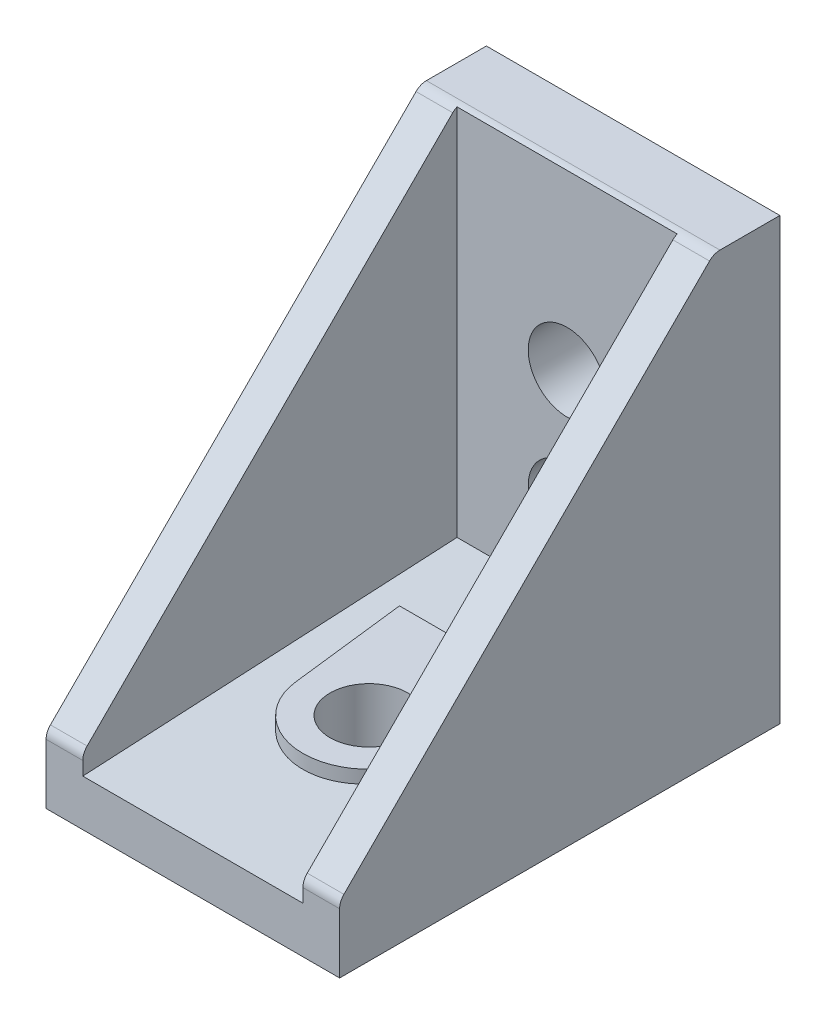
from build123d import *
from build123d.topology import SkipClean

# Parameters (mm, degrees)
BOSS_EXTRUDE1_DEPTH      = 10
BOSS_EXTRUDE1_DEPTH_BACK = 10
CUT_EXTRUDE1_DEPTH       = 7.5
CUT_EXTRUDE1_DEPTH_BACK  = 7.5
BOSS_EXTRUDE2_DEPTH      = 2.25
SKETCH4_R                = 2.65
CUT_EXTRUDE2_DEPTH       = 4.5
SKETCH5_R                = 2.65
CUT_EXTRUDE3_DEPTH       = 4.5
SKETCH6_R                = 2.65
CUT_EXTRUDE4_DEPTH       = 4.5
SKETCH7_W                = 20
SKETCH7_H                = 30
BOSS_EXTRUDE3_DEPTH      = 1
SKETCH8_W                = 20
SKETCH8_H                = 30
CUT_EXTRUDE5_DEPTH       = 1
SKETCH9_W                = 20
SKETCH9_H                = 30
BOSS_EXTRUDE4_DEPTH      = 1
CUT_EXTRUDE6_START       = -1
SKETCH10_W               = 20
SKETCH10_H               = 30
CUT_EXTRUDE6_DEPTH       = 1


with BuildPart() as part:
    # Sketch1 → Boss-Extrude1 (new, two sides: drawn at the far end of the back side and taken through both)
    with BuildSketch(Plane(origin=(0, 0, 0), x_dir=(0, 0, -1), z_dir=(1, 0, 0)).offset(-BOSS_EXTRUDE1_DEPTH_BACK)):
        with BuildLine():
            Line((-30, 4.085786438), (-30, 0))
            Line((-30, 0), (0, 0))
            Line((0, 0), (0, 30))
            Line((0, 30), (-4.085786438, 30))
            ThreePointArc((-4.085786438, 30), (-4.46846987, 29.923879533), (-4.792893219, 29.707106781))
            Line((-4.792893219, 29.707106781), (-29.707106781, 4.792893219))
            ThreePointArc((-29.707106781, 4.792893219), (-29.923879533, 4.46846987), (-30, 4.085786438))
        make_face()
    extrude(amount=BOSS_EXTRUDE1_DEPTH + BOSS_EXTRUDE1_DEPTH_BACK)

    # Sketch2 → Cut-Extrude1 (cut, two sides: drawn at the far end of the back side and taken through both)
    with BuildSketch(Plane(origin=(0, 0, 0), x_dir=(0, 0, -1), z_dir=(1, 0, 0)).offset(-CUT_EXTRUDE1_DEPTH_BACK)):
        Polygon((-34.5, 34.5), (-34.5, 2.927766622), (-4.5, 4.5), (-4.5, 34.5), align=None)
    extrude(amount=CUT_EXTRUDE1_DEPTH + CUT_EXTRUDE1_DEPTH_BACK, mode=Mode.SUBTRACT)

    # Sketch3 → Boss-Extrude2 (add)
    with BuildSketch(Plane(origin=(0, 4.5, 0), x_dir=(1, 0, 0), z_dir=(0, 1, 0))):
        with BuildLine():
            Line((-5.420884207, -10.5), (-4.4686916, -18.529901296))
            ThreePointArc((-4.4686916, -18.529901296), (0, -22.5), (4.4686916, -18.529901296))
            Line((4.4686916, -18.529901296), (5.420884207, -10.5))
            Line((5.420884207, -10.5), (-5.420884207, -10.5))
        make_face()
    extrude(amount=-BOSS_EXTRUDE2_DEPTH)

    # Sketch4 → Cut-Extrude2 (cut)
    with BuildSketch(Plane.XY):
        with Locations((0, 18)):
            Circle(SKETCH4_R)
    extrude(amount=CUT_EXTRUDE2_DEPTH, mode=Mode.SUBTRACT)

    # Sketch5 → Cut-Extrude3 (cut)
    with BuildSketch(Plane.XY):
        with Locations((0, 10)):
            Circle(SKETCH5_R)
    extrude(amount=CUT_EXTRUDE3_DEPTH, mode=Mode.SUBTRACT)

    # Sketch6 → Cut-Extrude4 (cut)
    with BuildSketch(Plane(origin=(0, 0, 0), x_dir=(1, 0, 0), z_dir=(0, 1, 0))):
        with Locations((0, -18)):
            Circle(SKETCH6_R)
    extrude(amount=CUT_EXTRUDE4_DEPTH, mode=Mode.SUBTRACT)

    # Sketch7 → Boss-Extrude3 (add)
    with BuildSketch(Plane(origin=(0, 0, 0), x_dir=(1, 0, 0), z_dir=(0, 1, 0))):
        with Locations((0, -15)):
            Rectangle(SKETCH7_W, SKETCH7_H)
    extrude(amount=-BOSS_EXTRUDE3_DEPTH)

    # Sketch8 → Cut-Extrude5 (cut)
    with BuildSketch(Plane(origin=(0, 0, 0), x_dir=(1, 0, 0), z_dir=(0, 1, 0))):
        with Locations((0, -15)):
            Rectangle(SKETCH8_W, SKETCH8_H)
        with BuildLine():
            Line((-3, -24.3), (-3, -26.7))
            ThreePointArc((-3, -26.7), (-2.912132034, -26.912132034), (-2.7, -27))
            Line((-2.7, -27), (2.7, -27))
            ThreePointArc((2.7, -27), (2.912132034, -26.912132034), (3, -26.7))
            Line((3, -26.7), (3, -24.3))
            ThreePointArc((3, -24.3), (2.912132034, -24.087867966), (2.7, -24))
            Line((2.7, -24), (-2.7, -24))
            ThreePointArc((-2.7, -24), (-2.912132034, -24.087867966), (-3, -24.3))
        make_face(mode=Mode.SUBTRACT)
        with BuildLine():
            Line((-3, -5.3), (-3, -10.7))
            ThreePointArc((-3, -10.7), (-2.912132034, -10.912132034), (-2.7, -11))
            Line((-2.7, -11), (2.7, -11))
            ThreePointArc((2.7, -11), (2.912132034, -10.912132034), (3, -10.7))
            Line((3, -10.7), (3, -5.3))
            ThreePointArc((3, -5.3), (2.912132034, -5.087867966), (2.7, -5))
            Line((2.7, -5), (-2.7, -5))
            ThreePointArc((-2.7, -5), (-2.912132034, -5.087867966), (-3, -5.3))
        make_face(mode=Mode.SUBTRACT)
    extrude(amount=-CUT_EXTRUDE5_DEPTH, mode=Mode.SUBTRACT)

    # Sketch9 → Boss-Extrude4 (add)
    with BuildSketch(Plane.XY):
        with Locations((0, 15)):
            Rectangle(SKETCH9_W, SKETCH9_H)
    extrude(amount=-BOSS_EXTRUDE4_DEPTH)

    # Sketch10 → Cut-Extrude6 (cut)
    with SkipClean():  # the faces are left unmerged after this step: merging them gives an invalid solid
        with BuildSketch(Plane.XY.offset(CUT_EXTRUDE6_START)):
            with Locations((0, 15)):
                Rectangle(SKETCH10_W, SKETCH10_H)
            with BuildLine():
                Line((2.602402736, 10.5), (3, 10.5))
                Line((3, 10.5), (3, 12))
                ThreePointArc((3, 12), (2.707106781, 12.707106781), (2, 13))
                Line((2, 13), (0.5, 13))
                Line((0.5, 13), (0.5, 12.602402736))
                ThreePointArc((0.5, 12.602402736), (1.87383297, 11.87383297), (2.602402736, 10.5))
            make_face(mode=Mode.SUBTRACT)
            with BuildLine():
                Line((0.5, 7.397597264), (0.5, 7))
                Line((0.5, 7), (2, 7))
                ThreePointArc((2, 7), (2.707106781, 7.292893219), (3, 8))
                Line((3, 8), (3, 9.5))
                Line((3, 9.5), (2.602402736, 9.5))
                ThreePointArc((2.602402736, 9.5), (1.87383297, 8.12616703), (0.5, 7.397597264))
            make_face(mode=Mode.SUBTRACT)
            with BuildLine():
                Line((-3, 12), (-3, 10.5))
                Line((-3, 10.5), (-2.602402736, 10.5))
                ThreePointArc((-2.602402736, 10.5), (-1.87383297, 11.87383297), (-0.5, 12.602402736))
                Line((-0.5, 12.602402736), (-0.5, 13))
                Line((-0.5, 13), (-2, 13))
                ThreePointArc((-2, 13), (-2.707106781, 12.707106781), (-3, 12))
            make_face(mode=Mode.SUBTRACT)
            with BuildLine():
                Line((-3, 9.5), (-3, 8))
                ThreePointArc((-3, 8), (-2.707106781, 7.292893219), (-2, 7))
                Line((-2, 7), (-0.5, 7))
                Line((-0.5, 7), (-0.5, 7.397597264))
                ThreePointArc((-0.5, 7.397597264), (-1.87383297, 8.12616703), (-2.602402736, 9.5))
                Line((-2.602402736, 9.5), (-3, 9.5))
            make_face(mode=Mode.SUBTRACT)
        extrude(amount=CUT_EXTRUDE6_DEPTH, mode=Mode.SUBTRACT)


solid = part.part
